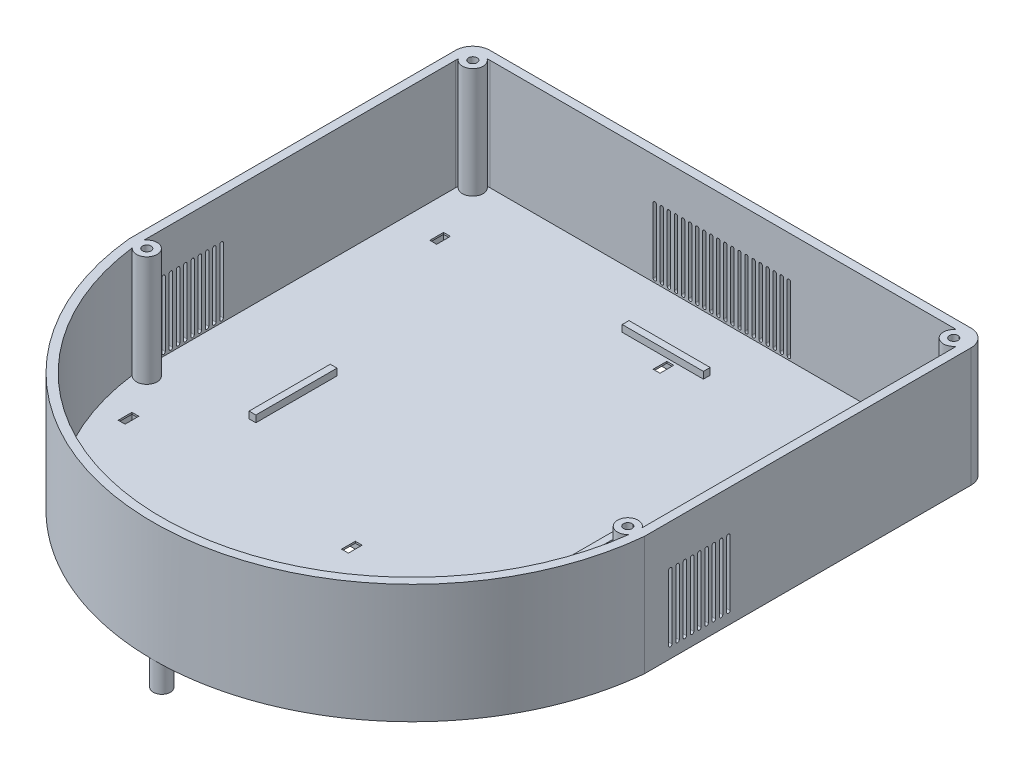
from build123d import *

# Parameters (mm, degrees)
BOSS_EXTRUDE1_DEPTH = 88
SHELL1_START        = 6.35
SHELL1_DEPTH        = 81.65
FILLET2_R           = 12.7
SKETCH3_R           = 7.62
SKETCH3_R_2         = 3.175
BOSS_EXTRUDE2_DEPTH = 81.65
SKETCH4_W           = 322.58
SKETCH4_H           = 12.7
CUT_EXTRUDE2_DEPTH  = 5.08
SKETCH5_W           = 5.08
SKETCH5_H           = 10.16
CUT_EXTRUDE3_DEPTH  = 298.806087916
CUT_EXTRUDE4_DEPTH  = 6.35
CUT_EXTRUDE5_DEPTH  = 374.65
SKETCH11_R          = 6.35
SKETCH11_R_2        = 3.81
BOSS_EXTRUDE4_DEPTH = 20.78
SKETCH13_W          = 60
SKETCH13_H          = 5
SKETCH13_W_2        = 5
SKETCH13_H_2        = 60
BOSS_EXTRUDE5_DEPTH = 5


# Read off the part's stored shape, not the designer's step: Shell1
with BuildPart() as part:
    # Sketch1 → Boss-Extrude1 (new body)
    with BuildSketch(Plane(origin=(0, 0, 0), x_dir=(1, 0, 0), z_dir=(0, 1, 0))):
        with BuildLine():
            ThreePointArc((-190.5, -40.64), (-128.571428175, -163.751574858), (-4.5e-07, -213.36))
            ThreePointArc((-4.5e-07, -213.36), (128.571427841, -163.75157516), (190.5, -40.64))
            Line((190.5, -40.64), (190.5, 213.36))
            Line((190.5, 213.36), (-190.5, 213.36))
            Line((-190.5, 213.36), (-190.5, -40.64))
        make_face()
    extrude(amount=BOSS_EXTRUDE1_DEPTH)

    # Shell1 outline → Shell1 (cut)
    with BuildSketch(Plane(origin=(0, 0, 0), x_dir=(1, 0, 0), z_dir=(0, 1, 0)).offset(SHELL1_START)):
        with BuildLine():
            ThreePointArc((-184.15, -40.32653284), (0, -207.01), (184.15, -40.32653284))
            Line((184.15, -40.32653284), (184.15, 207.01))
            Line((184.15, 207.01), (-184.15, 207.01))
            Line((-184.15, 207.01), (-184.15, -40.32653284))
        make_face()
    extrude(amount=SHELL1_DEPTH, mode=Mode.SUBTRACT)

    # Fillet2
    fillet2_edges = [part.edges().sort_by_distance(p)[0] for p in [
        (184.15, 47.175, -207.01),
        (-184.15, 47.175, -207.01),
        (-190.5, 44, -213.36),
        (190.5, 44, -213.36),
    ]]
    fillet(fillet2_edges, radius=FILLET2_R)

    # Sketch3 → Boss-Extrude2 (add)
    # profile 1 of 2: a face of its own
    with BuildSketch(Plane(origin=(0, 6.35, 0), x_dir=(1, 0, 0), z_dir=(0, 1, 0))):
        with Locations((-177.8, 200.66)):
            Circle(SKETCH3_R)
        with Locations(Location((-177.8, 200.66, 0), (0, 0, 270))):
            Circle(SKETCH3_R_2, mode=Mode.SUBTRACT)
    # profile 2 of 2: a face of its own
    with BuildSketch(Plane(origin=(0, 6.35, 0), x_dir=(1, 0, 0), z_dir=(0, 1, 0))):
        with Locations((-177.8, -40.32653284)):
            Circle(SKETCH3_R)
        with Locations(Location((-177.8, -40.32653284, 0), (0, 0, 270))):
            Circle(SKETCH3_R_2, mode=Mode.SUBTRACT)
    boss_extrude2 = extrude(amount=BOSS_EXTRUDE2_DEPTH)

    # Mirror1: Boss-Extrude2 across plane
    add(boss_extrude2.mirror(Plane(origin=(0, 0, 0), x_dir=(0, 0, 1), z_dir=(1, 0, 0))))

    # Sketch4 → Cut-Extrude2 (cut)
    with BuildSketch(Plane.XZ):
        with Locations((0, -156.21)):
            Rectangle(SKETCH4_W, SKETCH4_H)
        with Locations((0, 74.168)):
            Rectangle(SKETCH4_W, SKETCH4_H)
    extrude(amount=-CUT_EXTRUDE2_DEPTH, mode=Mode.SUBTRACT)

    # Sketch5 → Cut-Extrude3 (cut, through all)
    with BuildSketch(Plane.XZ.offset(-5.08)):
        with Locations((-157.48, 74.168)):
            Rectangle(SKETCH5_W, SKETCH5_H)
        with Locations((7.62, 74.168)):
            Rectangle(SKETCH5_W, SKETCH5_H)
        with Locations((-157.48, -156.21)):
            Rectangle(SKETCH5_W, SKETCH5_H)
        with Locations((7.62, -156.21)):
            Rectangle(SKETCH5_W, SKETCH5_H)
    extrude(amount=-CUT_EXTRUDE3_DEPTH, mode=Mode.SUBTRACT)

    # Sketch8 → Cut-Extrude4 (cut)
    with BuildSketch(Plane(origin=(0, 0, -213.36), x_dir=(-1, 0, 0), z_dir=(0, 0, -1))):
        with BuildLine():
            Line((-48.26, 57.15), (-48.26, 8.89))
            ThreePointArc((-48.26, 8.89), (-49.53, 7.62), (-50.8, 8.89))
            Line((-50.8, 8.89), (-50.8, 57.15))
            ThreePointArc((-50.8, 57.15), (-49.53, 58.42), (-48.26, 57.15))
        make_face()
        with BuildLine():
            Line((-45.586315789, 57.15), (-45.586315789, 8.89))
            ThreePointArc((-45.586315789, 8.89), (-44.316315789, 7.62), (-43.046315789, 8.89))
            Line((-43.046315789, 8.89), (-43.046315789, 57.15))
            ThreePointArc((-43.046315789, 57.15), (-44.316315789, 58.42), (-45.586315789, 57.15))
        make_face()
        with BuildLine():
            Line((-40.372631579, 57.15), (-40.372631579, 8.89))
            ThreePointArc((-40.372631579, 8.89), (-39.102631579, 7.62), (-37.832631579, 8.89))
            Line((-37.832631579, 8.89), (-37.832631579, 57.15))
            ThreePointArc((-37.832631579, 57.15), (-39.102631579, 58.42), (-40.372631579, 57.15))
        make_face()
        with BuildLine():
            Line((-35.158947368, 57.15), (-35.158947368, 8.89))
            ThreePointArc((-35.158947368, 8.89), (-33.888947368, 7.62), (-32.618947368, 8.89))
            Line((-32.618947368, 8.89), (-32.618947368, 57.15))
            ThreePointArc((-32.618947368, 57.15), (-33.888947368, 58.42), (-35.158947368, 57.15))
        make_face()
        with BuildLine():
            Line((-29.945263158, 57.15), (-29.945263158, 8.89))
            ThreePointArc((-29.945263158, 8.89), (-28.675263158, 7.62), (-27.405263158, 8.89))
            Line((-27.405263158, 8.89), (-27.405263158, 57.15))
            ThreePointArc((-27.405263158, 57.15), (-28.675263158, 58.42), (-29.945263158, 57.15))
        make_face()
        with BuildLine():
            Line((-24.731578947, 57.15), (-24.731578947, 8.89))
            ThreePointArc((-24.731578947, 8.89), (-23.461578947, 7.62), (-22.191578947, 8.89))
            Line((-22.191578947, 8.89), (-22.191578947, 57.15))
            ThreePointArc((-22.191578947, 57.15), (-23.461578947, 58.42), (-24.731578947, 57.15))
        make_face()
        with BuildLine():
            Line((-19.517894737, 57.15), (-19.517894737, 8.89))
            ThreePointArc((-19.517894737, 8.89), (-18.247894737, 7.62), (-16.977894737, 8.89))
            Line((-16.977894737, 8.89), (-16.977894737, 57.15))
            ThreePointArc((-16.977894737, 57.15), (-18.247894737, 58.42), (-19.517894737, 57.15))
        make_face()
        with BuildLine():
            Line((-14.304210526, 57.15), (-14.304210526, 8.89))
            ThreePointArc((-14.304210526, 8.89), (-13.034210526, 7.62), (-11.764210526, 8.89))
            Line((-11.764210526, 8.89), (-11.764210526, 57.15))
            ThreePointArc((-11.764210526, 57.15), (-13.034210526, 58.42), (-14.304210526, 57.15))
        make_face()
        with BuildLine():
            Line((-9.090526316, 57.15), (-9.090526316, 8.89))
            ThreePointArc((-9.090526316, 8.89), (-7.820526316, 7.62), (-6.550526316, 8.89))
            Line((-6.550526316, 8.89), (-6.550526316, 57.15))
            ThreePointArc((-6.550526316, 57.15), (-7.820526316, 58.42), (-9.090526316, 57.15))
        make_face()
        with BuildLine():
            Line((-3.876842105, 57.15), (-3.876842105, 8.89))
            ThreePointArc((-3.876842105, 8.89), (-2.606842105, 7.62), (-1.336842105, 8.89))
            Line((-1.336842105, 8.89), (-1.336842105, 57.15))
            ThreePointArc((-1.336842105, 57.15), (-2.606842105, 58.42), (-3.876842105, 57.15))
        make_face()
        with BuildLine():
            Line((1.336842105, 57.15), (1.336842105, 8.89))
            ThreePointArc((1.336842105, 8.89), (2.606842105, 7.62), (3.876842105, 8.89))
            Line((3.876842105, 8.89), (3.876842105, 57.15))
            ThreePointArc((3.876842105, 57.15), (2.606842105, 58.42), (1.336842105, 57.15))
        make_face()
        with BuildLine():
            Line((6.550526316, 57.15), (6.550526316, 8.89))
            ThreePointArc((6.550526316, 8.89), (7.820526316, 7.62), (9.090526316, 8.89))
            Line((9.090526316, 8.89), (9.090526316, 57.15))
            ThreePointArc((9.090526316, 57.15), (7.820526316, 58.42), (6.550526316, 57.15))
        make_face()
        with BuildLine():
            Line((11.764210526, 57.15), (11.764210526, 8.89))
            ThreePointArc((11.764210526, 8.89), (13.034210526, 7.62), (14.304210526, 8.89))
            Line((14.304210526, 8.89), (14.304210526, 57.15))
            ThreePointArc((14.304210526, 57.15), (13.034210526, 58.42), (11.764210526, 57.15))
        make_face()
        with BuildLine():
            Line((16.977894737, 57.15), (16.977894737, 8.89))
            ThreePointArc((16.977894737, 8.89), (18.247894737, 7.62), (19.517894737, 8.89))
            Line((19.517894737, 8.89), (19.517894737, 57.15))
            ThreePointArc((19.517894737, 57.15), (18.247894737, 58.42), (16.977894737, 57.15))
        make_face()
        with BuildLine():
            Line((22.191578947, 57.15), (22.191578947, 8.89))
            ThreePointArc((22.191578947, 8.89), (23.461578947, 7.62), (24.731578947, 8.89))
            Line((24.731578947, 8.89), (24.731578947, 57.15))
            ThreePointArc((24.731578947, 57.15), (23.461578947, 58.42), (22.191578947, 57.15))
        make_face()
        with BuildLine():
            Line((27.405263158, 57.15), (27.405263158, 8.89))
            ThreePointArc((27.405263158, 8.89), (28.675263158, 7.62), (29.945263158, 8.89))
            Line((29.945263158, 8.89), (29.945263158, 57.15))
            ThreePointArc((29.945263158, 57.15), (28.675263158, 58.42), (27.405263158, 57.15))
        make_face()
        with BuildLine():
            Line((32.618947368, 57.15), (32.618947368, 8.89))
            ThreePointArc((32.618947368, 8.89), (33.888947368, 7.62), (35.158947368, 8.89))
            Line((35.158947368, 8.89), (35.158947368, 57.15))
            ThreePointArc((35.158947368, 57.15), (33.888947368, 58.42), (32.618947368, 57.15))
        make_face()
        with BuildLine():
            Line((37.832631579, 57.15), (37.832631579, 8.89))
            ThreePointArc((37.832631579, 8.89), (39.102631579, 7.62), (40.372631579, 8.89))
            Line((40.372631579, 8.89), (40.372631579, 57.15))
            ThreePointArc((40.372631579, 57.15), (39.102631579, 58.42), (37.832631579, 57.15))
        make_face()
        with BuildLine():
            Line((43.046315789, 57.15), (43.046315789, 8.89))
            ThreePointArc((43.046315789, 8.89), (44.316315789, 7.62), (45.586315789, 8.89))
            Line((45.586315789, 8.89), (45.586315789, 57.15))
            ThreePointArc((45.586315789, 57.15), (44.316315789, 58.42), (43.046315789, 57.15))
        make_face()
        with BuildLine():
            Line((48.26, 57.15), (48.26, 8.89))
            ThreePointArc((48.26, 8.89), (49.53, 7.62), (50.8, 8.89))
            Line((50.8, 8.89), (50.8, 57.15))
            ThreePointArc((50.8, 57.15), (49.53, 58.42), (48.26, 57.15))
        make_face()
    extrude(amount=-CUT_EXTRUDE4_DEPTH, mode=Mode.SUBTRACT)

    # Sketch10 → Cut-Extrude5 (cut)
    with BuildSketch(Plane(origin=(190.5, 0, 0), x_dir=(0, 0, -1), z_dir=(1, 0, 0))):
        with BuildLine():
            ThreePointArc((-20.32, 57.15), (-20.691974388, 58.048025612), (-21.59, 58.42))
            ThreePointArc((-21.59, 58.42), (-22.488025612, 58.048025612), (-22.86, 57.15))
            Line((-22.86, 57.15), (-22.86, 8.89))
            ThreePointArc((-22.86, 8.89), (-22.488025613, 7.991974389), (-21.590000002, 7.62))
            ThreePointArc((-21.590000002, 7.62), (-20.691974389, 7.991974387), (-20.32, 8.89))
            Line((-20.32, 8.89), (-20.32, 57.15))
        make_face()
        with BuildLine():
            Line((-17.497777778, 57.15), (-17.497777778, 8.89))
            ThreePointArc((-17.497777778, 8.89), (-16.227777778, 7.62), (-14.957777778, 8.89))
            Line((-14.957777778, 8.89), (-14.957777778, 57.15))
            ThreePointArc((-14.957777778, 57.15), (-16.227777778, 58.42), (-17.497777778, 57.15))
        make_face()
        with BuildLine():
            Line((-6.773333333, 57.15), (-6.773333333, 8.89))
            ThreePointArc((-6.773333333, 8.89), (-5.503333333, 7.62), (-4.233333333, 8.89))
            Line((-4.233333333, 8.89), (-4.233333333, 57.15))
            ThreePointArc((-4.233333333, 57.15), (-5.503333333, 58.42), (-6.773333333, 57.15))
        make_face()
        with BuildLine():
            Line((3.951111111, 57.15), (3.951111111, 8.89))
            ThreePointArc((3.951111111, 8.89), (5.221111111, 7.62), (6.491111111, 8.89))
            Line((6.491111111, 8.89), (6.491111111, 57.15))
            ThreePointArc((6.491111111, 57.15), (5.221111111, 58.42), (3.951111111, 57.15))
        make_face()
        with BuildLine():
            Line((9.313333333, 57.15), (9.313333333, 8.89))
            ThreePointArc((9.313333333, 8.89), (10.583333333, 7.62), (11.853333333, 8.89))
            Line((11.853333333, 8.89), (11.853333333, 57.15))
            ThreePointArc((11.853333333, 57.15), (10.583333333, 58.42), (9.313333333, 57.15))
        make_face()
        with BuildLine():
            Line((14.675555556, 57.15), (14.675555556, 8.89))
            ThreePointArc((14.675555556, 8.89), (15.945555556, 7.62), (17.215555556, 8.89))
            Line((17.215555556, 8.89), (17.215555556, 57.15))
            ThreePointArc((17.215555556, 57.15), (15.945555556, 58.42), (14.675555556, 57.15))
        make_face()
        with BuildLine():
            Line((20.037777778, 57.15), (20.037777778, 8.89))
            ThreePointArc((20.037777778, 8.89), (21.307777778, 7.62), (22.577777778, 8.89))
            Line((22.577777778, 8.89), (22.577777778, 57.15))
            ThreePointArc((22.577777778, 57.15), (21.307777778, 58.42), (20.037777778, 57.15))
        make_face()
        with BuildLine():
            Line((-12.135555556, 57.15), (-12.135555556, 8.89))
            ThreePointArc((-12.135555556, 8.89), (-10.865555556, 7.62), (-9.595555556, 8.89))
            Line((-9.595555556, 8.89), (-9.595555556, 57.15))
            ThreePointArc((-9.595555556, 57.15), (-10.865555556, 58.42), (-12.135555556, 57.15))
        make_face()
        with BuildLine():
            Line((1.128888889, 57.15), (1.128888889, 8.89))
            ThreePointArc((1.128888889, 8.89), (-0.141111111, 7.62), (-1.411111111, 8.89))
            Line((-1.411111111, 8.89), (-1.411111111, 57.15))
            ThreePointArc((-1.411111111, 57.15), (-0.141111111, 58.42), (1.128888889, 57.15))
        make_face()
    cut_extrude5 = extrude(amount=-CUT_EXTRUDE5_DEPTH, mode=Mode.SUBTRACT)

    # Mirror2: Cut-Extrude5 across plane
    add(cut_extrude5.mirror(Plane(origin=(0, 0, 0), x_dir=(0, 0, 1), z_dir=(1, 0, 0))), mode=Mode.SUBTRACT)

    # Sketch11 → Boss-Extrude4 (add)
    with BuildSketch(Plane.XZ):
        with Locations(Location((0, 207.01, 0), (0, 0, 89.999673465))):
            Circle(SKETCH11_R)
        with Locations(Location((0, 207.01, 0), (0, 0, 270))):
            Circle(SKETCH11_R_2, mode=Mode.SUBTRACT)
    extrude(amount=BOSS_EXTRUDE4_DEPTH)

    # Sketch13 → Boss-Extrude5 (add)
    with BuildSketch(Plane(origin=(0, 6.35, 0), x_dir=(1, 0, 0), z_dir=(0, 1, 0))):
        with Locations((0, 165.86)):
            Rectangle(SKETCH13_W, SKETCH13_H)
        with Locations((-110, 0)):
            Rectangle(SKETCH13_W_2, SKETCH13_H_2)
        with Locations((0, -168.14)):
            Rectangle(SKETCH13_W, SKETCH13_H)
        with Locations((101.65, 0)):
            Rectangle(SKETCH13_W_2, SKETCH13_H_2)
    extrude(amount=BOSS_EXTRUDE5_DEPTH)


solid = part.part
